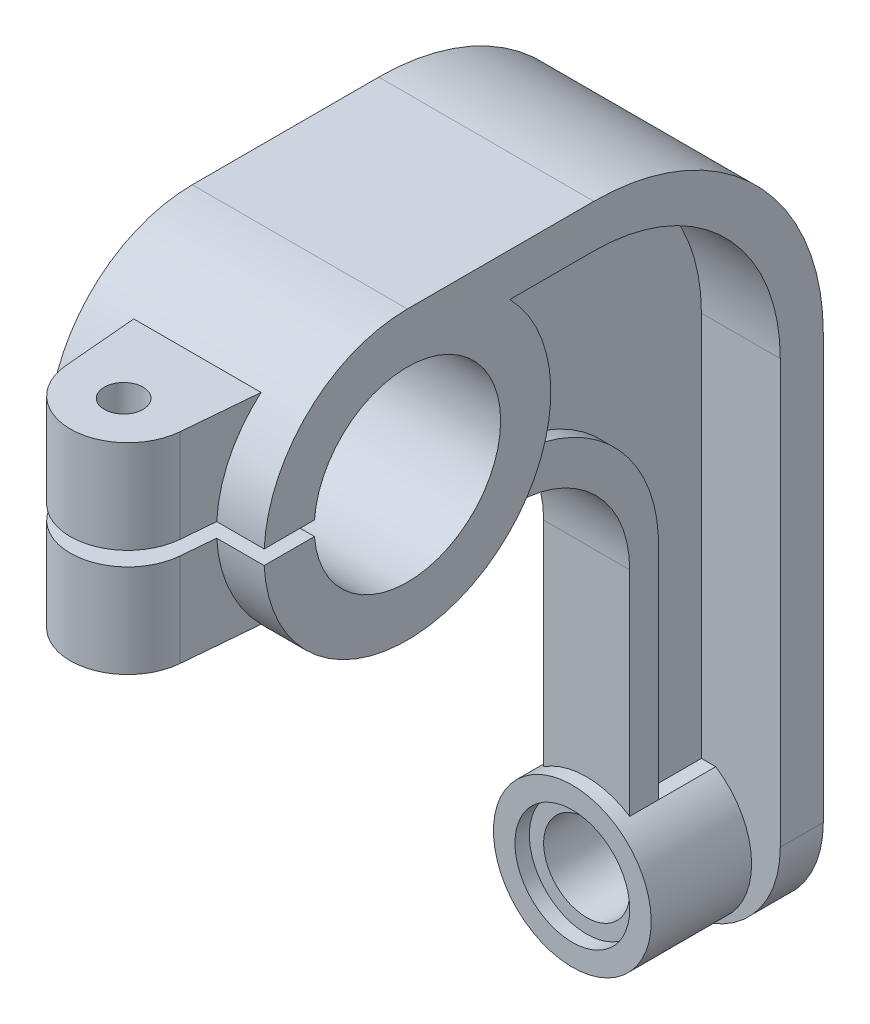
from build123d import *

# Parameters (mm, degrees)
SKETCH1_R                = 32.5
BOSS_EXTRUDE1_DEPTH      = 75
FILLET1_R                = 80
CUT_EXTRUDE3_DEPTH       = 35
FILLET2_R                = 37.5
CUT_EXTRUDE13_DEPTH      = 5
FILLET6_R                = 40
CUT_EXTRUDE14_START      = -27.5
CUT_EXTRUDE14_DEPTH      = 27.5
CUT_EXTRUDE15_START      = -22.5
CUT_EXTRUDE15_DEPTH      = 22.5
SKETCH9_R                = 15
CUT_EXTRUDE16_DEPTH      = 231.204488166
SKETCH10_R               = 20
CUT_EXTRUDE17_DEPTH      = 5
BOSS_EXTRUDE2_DEPTH      = 70
CUT_EXTRUDE20_REACH      = 289.392
CUT_EXTRUDE20_END_RADIUS = 32.5
SKETCH18_W               = 75
SKETCH18_H               = 5


with BuildPart() as part:
    # Sketch1 → Boss-Extrude1 (new body)
    with BuildSketch(Plane.YZ):
        with BuildLine():
            Line((162.308676206, -25), (-102.691323794, -25))
            Line((-102.691323794, -25), (-102.691323794, 25))
            Line((-102.691323794, 25), (62.308676206, 25))
            Line((62.308676206, 25), (62.308676206, 120))
            ThreePointArc((62.308676206, 120), (112.308676206, 170), (162.308676206, 120))
            Line((162.308676206, 120), (162.308676206, -25))
        make_face()
        with Locations(Location((112.308676206, 120, 0), (0, 0, 270))):
            Circle(SKETCH1_R, mode=Mode.SUBTRACT)
    extrude(amount=BOSS_EXTRUDE1_DEPTH)

    # Fillet1
    fillet1_edges = [part.edges().sort_by_distance(p)[0] for p in [
        (37.5, 162.308676206, -25),
    ]]
    fillet(fillet1_edges, radius=FILLET1_R)

    # Sketch3 → Cut-Extrude3 (cut)
    with BuildSketch(Plane.XY.offset(25)):
        with BuildLine():
            Line((75, 62.308676206), (52.5, 62.308676206))
            Line((52.5, 62.308676206), (52.5, -52.14246265))
            ThreePointArc((52.5, -52.14246265), (61.673849507, -62.081213191), (65, -75.191323794))
            ThreePointArc((65, -75.191323794), (56.945436483, -94.636760276), (37.5, -102.691323794))
            Line((37.5, -102.691323794), (75, -102.691323794))
            Line((75, -102.691323794), (75, 62.308676206))
        make_face()
        with BuildLine():
            Line((22.5, -52.14246265), (22.5, 62.308676206))
            Line((22.5, 62.308676206), (0, 62.308676206))
            Line((0, 62.308676206), (0, -102.691323794))
            Line((0, -102.691323794), (37.5, -102.691323794))
            ThreePointArc((37.5, -102.691323794), (11.136258977, -83.014568599), (22.5, -52.14246265))
        make_face()
    extrude(amount=-CUT_EXTRUDE3_DEPTH, mode=Mode.SUBTRACT)

    # Fillet2
    fillet2_edges = [part.edges().sort_by_distance(p)[0] for p in [
        (0, -102.691323794, -17.5),
        (75, -102.691323794, -17.5),
    ]]
    fillet(fillet2_edges, radius=FILLET2_R - 0.0001)  # a hair under: the kernel refuses the full size

    # Sketch7 → Cut-Extrude13 (cut)
    with BuildSketch(Plane.XY.offset(25)):
        with BuildLine():
            Line((52.5, 62.308676206), (22.5, 62.308676206))
            Line((22.5, 62.308676206), (22.5, -52.14246265))
            ThreePointArc((22.5, -52.14246265), (37.5, -47.691323794), (52.5, -52.14246265))
            Line((52.5, -52.14246265), (52.5, 62.308676206))
        make_face()
    extrude(amount=-CUT_EXTRUDE13_DEPTH, mode=Mode.SUBTRACT)

    # Fillet6
    fillet6_edges = [part.edges().sort_by_distance(p)[0] for p in [
        (37.5, 62.308676206, 20),
    ]]
    fillet(fillet6_edges, radius=FILLET6_R)

    # Sketch5 → Cut-Extrude14 (cut)
    with BuildSketch(Plane.YZ.offset(75).offset(CUT_EXTRUDE14_START)):
        with BuildLine():
            ThreePointArc((77.308676206, 60), (72.970807341, 41.454593742), (62.308676206, 25.672700343))
            Line((62.308676206, 25.672700343), (62.308676206, 25))
            Line((62.308676206, 25), (62.308676206, -10))
            Line((62.308676206, -10), (82.308676206, -10))
            ThreePointArc((82.308676206, -10), (128.270616984, 9.038059223), (147.308676206, 55))
            Line((147.308676206, 55), (147.308676206, 84.292857857))
            ThreePointArc((147.308676206, 84.292857857), (112.308676206, 70), (77.308676206, 84.292857857))
            Line((77.308676206, 84.292857857), (77.308676206, 60))
        make_face()
        with BuildLine():
            Line((22.308676206, 10), (-52.14246265, 10))
            Line((-52.14246265, 10), (-52.14246265, -10))
            Line((-52.14246265, -10), (62.308676206, -10))
            Line((62.308676206, -10), (62.308676206, 25))
            Line((62.308676206, 25), (62.308676206, 25.672700343))
            ThreePointArc((62.308676206, 25.672700343), (43.98309625, 13.562881), (22.308676206, 10))
        make_face()
    cut_extrude14 = extrude(amount=CUT_EXTRUDE14_DEPTH, mode=Mode.SUBTRACT)

    # Sketch8 → Cut-Extrude15 (cut)
    with BuildSketch(Plane.YZ.offset(75).offset(CUT_EXTRUDE15_START)):
        with BuildLine():
            ThreePointArc((62.308676206, 120), (66.21095392, 100.635083269), (77.308676206, 84.292857857))
            Line((77.308676206, 84.292857857), (77.308676206, 60))
            ThreePointArc((77.308676206, 60), (72.970807341, 41.454593742), (62.308676206, 25.672700343))
            Line((62.308676206, 25.672700343), (62.308676206, 120))
        make_face()
    cut_extrude15 = extrude(amount=CUT_EXTRUDE15_DEPTH, mode=Mode.SUBTRACT)

    # Mirror2: Cut-Extrude14, Cut-Extrude15 across plane
    add(cut_extrude14.mirror(Plane(origin=(37.5, 0, 0), x_dir=(0, 0, 1), z_dir=(1, 0, 0))), mode=Mode.SUBTRACT)
    add(cut_extrude15.mirror(Plane(origin=(37.5, 0, 0), x_dir=(0, 0, 1), z_dir=(1, 0, 0))), mode=Mode.SUBTRACT)

    # Sketch9 → Cut-Extrude16 (cut, through all)
    with BuildSketch(Plane.XY.offset(25)):
        with Locations((37.5, -75.191323794)):
            Circle(SKETCH9_R)
    cut_extrude16 = extrude(amount=-CUT_EXTRUDE16_DEPTH, mode=Mode.SUBTRACT)

    # Sketch10 → Cut-Extrude17 (cut)
    with BuildSketch(Plane.XY.offset(25)):
        with Locations((37.5, -75.191323794)):
            Circle(SKETCH10_R)
    cut_extrude17 = extrude(amount=-CUT_EXTRUDE17_DEPTH, mode=Mode.SUBTRACT)

    # Mirror3: Cut-Extrude16, Cut-Extrude17 across plane
    add(cut_extrude16.mirror(Plane.XY), mode=Mode.SUBTRACT)
    add(cut_extrude17.mirror(Plane.XY), mode=Mode.SUBTRACT)

    # Sketch13 → Boss-Extrude2 (add)
    with BuildSketch(Plane(origin=(0, 77.30867621, 0), x_dir=(-1, 0, 0), z_dir=(0, 1, 0))):
        with BuildLine():
            Line((-57.423893962, 181.743114855), (-59.932978613, 153.06414606))
            Line((-59.932978613, 153.06414606), (-15.067021387, 153.06414606))
            Line((-15.067021387, 153.06414606), (-17.576106038, 181.743114855))
            ThreePointArc((-17.576106038, 181.743114855), (-37.5, 200), (-57.423893962, 181.743114855))
        make_face()
    extrude(amount=BOSS_EXTRUDE2_DEPTH)

    # Sketch20 → CBORE for M14 Hex Head Cap Screw1 (revolve, cut)
    with BuildSketch(Plane(origin=(37.5, 77.30867621, 181.415910965), x_dir=(0, 0, -1), z_dir=(1, 0, 0))):
        Polygon((0, 0), (0, 84.999999996), (6.75, 84.999999996), (6.75, 6.6), (11, 6.6), (11, 2.223614023), (13.65, 0), align=None)
    revolve(axis=Axis((37.5, 70.95867621, 181.415910965), (0, 1, 0)), mode=Mode.SUBTRACT)

    # Cut-Extrude20: up to this cylinder (the profile starts outside it)
    cut_extrude20_end = Plane(origin=(37.5, 112.308676206, 120), z_dir=(-1, 0, 0)) * Cylinder(CUT_EXTRUDE20_END_RADIUS, 644.784, mode=Mode.PRIVATE)
    # Sketch18 → Cut-Extrude20 (cut, up to the surface)
    with BuildSketch(Plane(origin=(0, 0, 200), x_dir=(-1, 0, 0), z_dir=(0, 0, -1)), mode=Mode.PRIVATE) as cut_extrude20_sk1:
        with Locations((-37.5, 112.308676206)):
            Rectangle(SKETCH18_W, SKETCH18_H)
    cut_extrude20_tool1 = extrude(cut_extrude20_sk1.sketch, amount=CUT_EXTRUDE20_REACH, mode=Mode.PRIVATE) - cut_extrude20_end
    add(cut_extrude20_tool1.solids().sort_by_distance((37.5, 112.308676, 200))[0], mode=Mode.SUBTRACT)


solid = part.part
